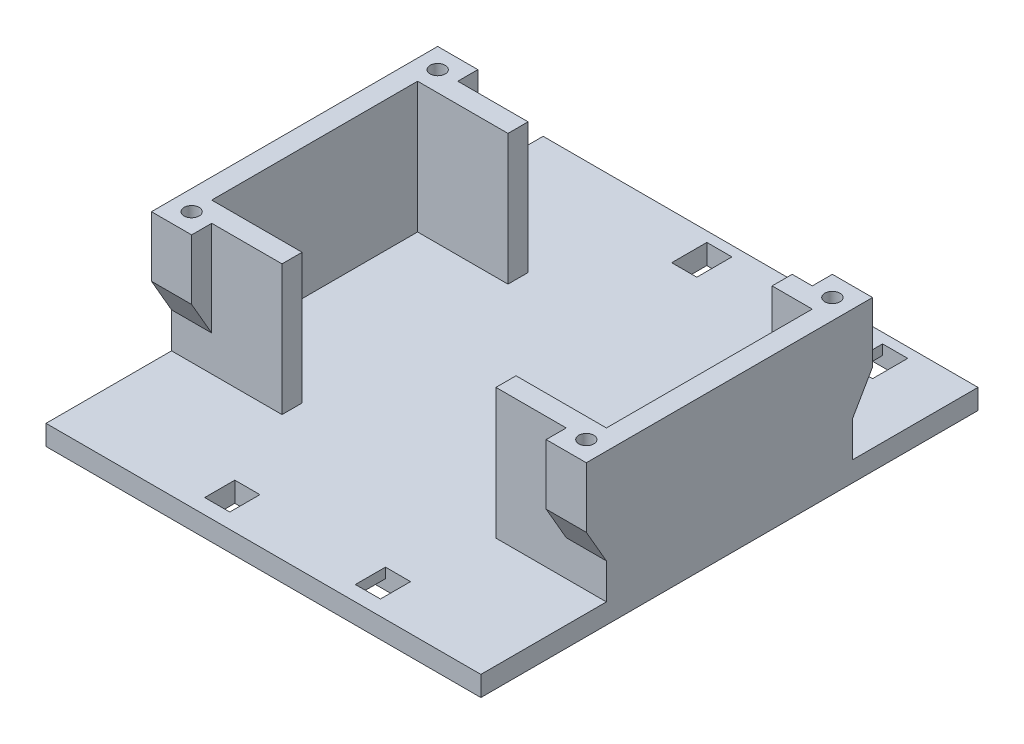
from build123d import *
from OCP.BRepFilletAPI import BRepFilletAPI_MakeChamfer

# Parameters (mm, degrees)
SKETCH1_W           = 43.3
SKETCH1_H           = 24.5
SKETCH1_W_2         = 39.3
SKETCH1_H_2         = 20.5
SKETCH1_H_3         = 12.5
BOSS_EXTRUDE1_DEPTH = 2
SKETCH1_3_W         = 43.3
SKETCH1_3_H         = 24.5
SKETCH1_3_W_2       = 39.3
SKETCH1_3_H_2       = 20.5
BOSS_EXTRUDE2_DEPTH = 15
SKETCH3_W           = 4
SKETCH3_H           = 2
BOSS_EXTRUDE4_DEPTH = 6
CHAMFER2_SIZE       = 3.464101615
CHAMFER2_SIZE_2     = 2
SKETCH4_R           = 0.75
CUT_EXTRUDE1_DEPTH  = 5
SKETCH5_W           = 26.3
SKETCH5_H           = 2
SKETCH5_W_2         = 21.3
CUT_EXTRUDE2_DEPTH  = 13
SKETCH7_W           = 2.5
SKETCH7_H           = 3.5
SKETCH7_H_2         = 3
CUT_EXTRUDE3_DEPTH  = 56.400812268
SKETCH8_W           = 15
SKETCH8_H           = 3.5
SKETCH8_W_2         = 12.5
SKETCH8_H_2         = 3
CUT_EXTRUDE4_DEPTH  = 1
SKETCH9_W           = 3
SKETCH9_H           = 2.5
CUT_EXTRUDE5_DEPTH  = 56.400812268
SKETCH10_W          = 3
SKETCH10_H          = 10
CUT_EXTRUDE6_DEPTH  = 1


with BuildPart() as part:
    # Sketch1 → Boss-Extrude1 (new body)
    # profile 1 of 4: a face of its own
    with BuildSketch(Plane(origin=(0, 0, 0), x_dir=(1, 0, 0), z_dir=(0, 1, 0))):
        with Locations((19.45, 10.05)):
            Rectangle(SKETCH1_W, SKETCH1_H)
        with Locations((19.45, 10.05)):
            Rectangle(SKETCH1_W_2, SKETCH1_H_2, mode=Mode.SUBTRACT)
    # profile 2 of 4: a face of its own
    with BuildSketch(Plane(origin=(0, 0, 0), x_dir=(1, 0, 0), z_dir=(0, 1, 0))):
        with Locations((19.45, 10.05)):
            Rectangle(SKETCH1_W_2, SKETCH1_H_2)
    # profile 3 of 4: a face of its own
    with BuildSketch(Plane(origin=(0, 0, 0), x_dir=(1, 0, 0), z_dir=(0, 1, 0))):
        with Locations((19.45, -8.45)):
            Rectangle(SKETCH1_W, SKETCH1_H_3)
    # profile 4 of 4: a face of its own
    with BuildSketch(Plane(origin=(0, 0, 0), x_dir=(1, 0, 0), z_dir=(0, 1, 0))):
        with Locations((19.45, 28.55)):
            Rectangle(SKETCH1_W, SKETCH1_H_3)
    extrude(amount=BOSS_EXTRUDE1_DEPTH)

    # Sketch1<3> → Boss-Extrude2 (add)
    with BuildSketch(Plane(origin=(0, 0, 0), x_dir=(1, 0, 0), z_dir=(0, 1, 0))):
        with Locations((19.45, 10.05)):
            Rectangle(SKETCH1_3_W, SKETCH1_3_H)
        with Locations((19.45, 10.05)):
            Rectangle(SKETCH1_3_W_2, SKETCH1_3_H_2, mode=Mode.SUBTRACT)
    extrude(amount=BOSS_EXTRUDE2_DEPTH)

    # Sketch3 → Boss-Extrude4 (add)
    with BuildSketch(Plane(origin=(0, 15, 0), x_dir=(1, 0, 0), z_dir=(0, 1, 0))):
        with Locations((-0.2, -3.2)):
            Rectangle(SKETCH3_W, SKETCH3_H)
        with Locations((39.1, -3.2)):
            Rectangle(SKETCH3_W, SKETCH3_H)
        with Locations((39.1, 23.3)):
            Rectangle(SKETCH3_W, SKETCH3_H)
        with Locations((-0.2, 23.3)):
            Rectangle(SKETCH3_W, SKETCH3_H)
    extrude(amount=-BOSS_EXTRUDE4_DEPTH)

    # Chamfer2
    chamfer2_edges_1 = [part.edges().sort_by_distance(p)[0] for p in [
        (-0.2, 9, -22.3),
    ]]
    chamfer2_side_1 = [part.faces().sort_by_distance(p)[0] for p in [
        (-0.2, 8.96, -22.3),
    ]]
    chamfer2_edges_2 = [part.edges().sort_by_distance(p)[0] for p in [
        (39.1, 9, -22.3),
    ]]
    chamfer2_side_2 = [part.faces().sort_by_distance(p)[0] for p in [
        (39.1, 9, -22.34),
    ]]
    chamfer2_edges_3 = [part.edges().sort_by_distance(p)[0] for p in [
        (39.1, 9, 2.2),
    ]]
    chamfer2_side_3 = [part.faces().sort_by_distance(p)[0] for p in [
        (39.1, 9, 2.24),
    ]]
    chamfer2_edges_4 = [part.edges().sort_by_distance(p)[0] for p in [
        (-0.2, 9, 2.2),
    ]]
    chamfer2_side_4 = [part.faces().sort_by_distance(p)[0] for p in [
        (-0.2, 9, 2.24),
    ]]
    chamfer2 = BRepFilletAPI_MakeChamfer(part.part.solid().wrapped)
    for e in chamfer2_edges_1:
        chamfer2.Add(CHAMFER2_SIZE - 0.0001, CHAMFER2_SIZE_2 - 0.0001, e.wrapped, chamfer2_side_1[0].wrapped)
    for e in chamfer2_edges_2:
        chamfer2.Add(CHAMFER2_SIZE_2 - 0.0001, CHAMFER2_SIZE - 0.0001, e.wrapped, chamfer2_side_2[0].wrapped)
    for e in chamfer2_edges_3:
        chamfer2.Add(CHAMFER2_SIZE_2 - 0.0001, CHAMFER2_SIZE - 0.0001, e.wrapped, chamfer2_side_3[0].wrapped)
    for e in chamfer2_edges_4:
        chamfer2.Add(CHAMFER2_SIZE_2 - 0.0001, CHAMFER2_SIZE - 0.0001, e.wrapped, chamfer2_side_4[0].wrapped)
    add(Compound.cast(chamfer2.Shape()), mode=Mode.REPLACE)  # a hair under: the kernel refuses the full size

    # Sketch4 → Cut-Extrude1 (cut)
    with BuildSketch(Plane(origin=(0, 15, 0), x_dir=(1, 0, 0), z_dir=(0, 1, 0))):
        with Locations(Location((-0.2, 22.3, 0), (0, 0, 270))):
            Circle(SKETCH4_R)
        with Locations(Location((-0.2, -2.2, 0), (0, 0, 270))):
            Circle(SKETCH4_R)
        with Locations(Location((39.1, -2.2, 0), (0, 0, 270))):
            Circle(SKETCH4_R)
        with Locations(Location((39.1, 22.3, 0), (0, 0, 270))):
            Circle(SKETCH4_R)
    extrude(amount=-CUT_EXTRUDE1_DEPTH, mode=Mode.SUBTRACT)

    # Sketch5 → Cut-Extrude2 (cut)
    with BuildSketch(Plane(origin=(0, 15, 0), x_dir=(1, 0, 0), z_dir=(0, 1, 0))):
        with Locations((21.95, 21.3)):
            Rectangle(SKETCH5_W, SKETCH5_H)
        with Locations((19.45, -1.2)):
            Rectangle(SKETCH5_W_2, SKETCH5_H)
    extrude(amount=-CUT_EXTRUDE2_DEPTH, mode=Mode.SUBTRACT)

    # Sketch7 → Cut-Extrude3 (cut, through all)
    with BuildSketch(Plane(origin=(0, 2, 0), x_dir=(1, 0, 0), z_dir=(0, 1, 0))):
        with Locations((16.35, 32.05)):
            Rectangle(SKETCH7_W, SKETCH7_H)
        with Locations((33.85, 32.05)):
            Rectangle(SKETCH7_W, SKETCH7_H)
        with Locations((13.35, -11.7)):
            Rectangle(SKETCH7_W, SKETCH7_H_2)
        with Locations((28.35, -11.7)):
            Rectangle(SKETCH7_W, SKETCH7_H_2)
    extrude(amount=-CUT_EXTRUDE3_DEPTH, mode=Mode.SUBTRACT)

    # Sketch8 → Cut-Extrude4 (cut)
    with BuildSketch(Plane.XZ):
        with Locations((25.1, -32.05)):
            Rectangle(SKETCH8_W, SKETCH8_H)
        with Locations((20.85, 11.7)):
            Rectangle(SKETCH8_W_2, SKETCH8_H_2)
    extrude(amount=-CUT_EXTRUDE4_DEPTH, mode=Mode.SUBTRACT)

    # Sketch9 → Cut-Extrude5 (cut, through all)
    with BuildSketch(Plane(origin=(0, 2, 0), x_dir=(1, 0, 0), z_dir=(0, 1, 0))):
        with Locations((0.3, 23.55)):
            Rectangle(SKETCH9_W, SKETCH9_H)
    extrude(amount=-CUT_EXTRUDE5_DEPTH, mode=Mode.SUBTRACT)

    # Sketch10 → Cut-Extrude6 (cut)
    with BuildSketch(Plane.XZ):
        with Locations((0.3, -29.8)):
            Rectangle(SKETCH10_W, SKETCH10_H)
    extrude(amount=-CUT_EXTRUDE6_DEPTH, mode=Mode.SUBTRACT)


solid = part.part
